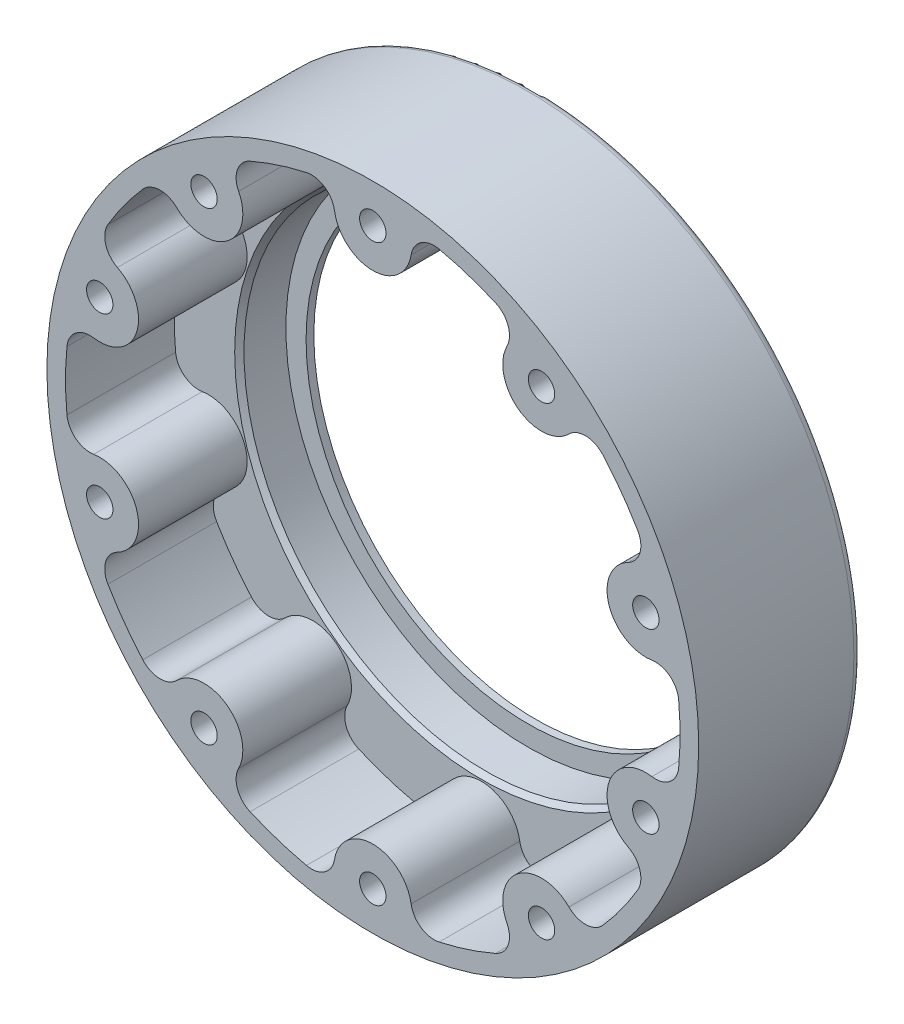
from build123d import *
from build123d.topology import SkipClean

# Parameters (mm, degrees)
ESQUISSE1_R             = 42
ESQUISSE1_R_2           = 31.2
BOSS_EXTRU_1_DEPTH      = 6
BOSS_EXTRU_2_START      = 1
ESQUISSE2_R             = 42
ESQUISSE2_R_2           = 28.6
BOSS_EXTRU_2_DEPTH      = 1
ESQUISSE3_R             = 5
BOSS_EXTRU_3_DEPTH      = 14
ESQUISSE4_R             = 42
ESQUISSE4_R_2           = 39.6
BOSS_EXTRU_4_DEPTH      = 14
CONG_1_R                = 3
ESQUISSE5_R             = 1.7
ENL_V_MAT_EXTRU_1_DEPTH = 64.000000167
ESQUISSE6_R             = 3
ENL_V_MAT_EXTRU_2_DEPTH = 3.2
CHANFREIN1_SIZE         = 0.6
CONG_2_R                = 1


with BuildPart() as part:
    # Esquisse1 → Boss.-Extru.1 (new body)
    with BuildSketch(Plane.XY):
        Circle(ESQUISSE1_R)
        Circle(ESQUISSE1_R_2, mode=Mode.SUBTRACT)
    extrude(amount=BOSS_EXTRU_1_DEPTH)

    # Esquisse2 → Boss.-Extru.2 (add)
    with BuildSketch(Plane(origin=(0, 0, 0), x_dir=(-1, 0, 0), z_dir=(0, 0, -1)).offset(BOSS_EXTRU_2_START)):
        Circle(ESQUISSE2_R)
        Circle(ESQUISSE2_R_2, mode=Mode.SUBTRACT)
    extrude(amount=-BOSS_EXTRU_2_DEPTH)

    # Esquisse3 → Boss.-Extru.3 (add)
    with BuildSketch(Plane.XY.offset(6)):
        with Locations(Location((0, 37, 0), (0, 0, 89.999613921))):
            Circle(ESQUISSE3_R)
        with Locations(Location((21.748054335, 29.933628792, 0), (0, 0, 53.999609041))):
            Circle(ESQUISSE3_R)
        with Locations(Location((35.189091103, 11.433628792, 0), (0, 0, 17.999603008))):
            Circle(ESQUISSE3_R)
        with Locations(Location((35.189091103, -11.433628792, 0), (0, 0, 341.999598271))):
            Circle(ESQUISSE3_R)
        with Locations(Location((21.748054335, -29.933628792, 0), (0, 0, 305.999596518))):
            Circle(ESQUISSE3_R)
        with Locations(Location((0, -37, 0), (0, 0, 269.999598257))):
            Circle(ESQUISSE3_R)
        with Locations(Location((-21.748054335, -29.933628792, 0), (0, 0, 233.999602875))):
            Circle(ESQUISSE3_R)
        with Locations(Location((-35.189091103, -11.433628792, 0), (0, 0, 197.999608525))):
            Circle(ESQUISSE3_R)
        with Locations(Location((-35.189091103, 11.433628792, 0), (0, 0, 161.99961318))):
            Circle(ESQUISSE3_R)
        with Locations(Location((-21.748054335, 29.933628792, 0), (0, 0, 125.999614883))):
            Circle(ESQUISSE3_R)
    extrude(amount=BOSS_EXTRU_3_DEPTH)

    # Esquisse4 → Boss.-Extru.4 (add)
    with SkipClean():  # the faces are left unmerged after this step: merging them gives an invalid solid
        with BuildSketch(Plane.XY.offset(6)):
            with Locations(Location((0, 0, 0), (0, 0, 180))):
                Circle(ESQUISSE4_R)
            Circle(ESQUISSE4_R_2, mode=Mode.SUBTRACT)
        extrude(amount=BOSS_EXTRU_4_DEPTH)

    # Congé1
    cong_1_edges = [part.edges().sort_by_distance(p)[0] for p in [
        (-4.411459412, 39.353513514, 13),
        (4.411459412, 39.353513514, 13),
        (19.562469235, 34.430652004, 13),
        (26.700360503, 29.244670437, 13),
        (36.064199538, 16.356451684, 13),
        (38.790631394, 7.965357244, 13),
        (38.790631394, -7.965357244, 13),
        (36.064199538, -16.356451684, 13),
        (26.700360503, -29.244670437, 13),
        (19.562469235, -34.430652004, 13),
        (4.411459412, -39.353513514, 13),
        (-4.411459412, -39.353513514, 13),
        (-19.562469235, -34.430652004, 13),
        (-26.700360503, -29.244670437, 13),
        (-36.064199538, -16.356451684, 13),
        (-38.790631394, -7.965357244, 13),
        (-38.790631394, 7.965357244, 13),
        (-36.064199538, 16.356451684, 13),
        (-26.700360503, 29.244670437, 13),
        (-19.562469235, 34.430652004, 13),
    ]]
    fillet(cong_1_edges, radius=CONG_1_R)

    # Esquisse5 → Enlèv. mat.-Extru.1 (cut, through all)
    with BuildSketch(Plane(origin=(0, 0, -1), x_dir=(-1, 0, 0), z_dir=(0, 0, -1))):
        with Locations((0, 37)):
            Circle(ESQUISSE5_R)
        with Locations((21.748054335, 29.933628792)):
            Circle(ESQUISSE5_R)
        with Locations((35.189091103, 11.433628792)):
            Circle(ESQUISSE5_R)
        with Locations((35.189091103, -11.433628792)):
            Circle(ESQUISSE5_R)
        with Locations((21.748054335, -29.933628792)):
            Circle(ESQUISSE5_R)
        with Locations((0, -37)):
            Circle(ESQUISSE5_R)
        with Locations((-21.748054335, -29.933628792)):
            Circle(ESQUISSE5_R)
        with Locations((-35.189091103, -11.433628792)):
            Circle(ESQUISSE5_R)
        with Locations((-35.189091103, 11.433628792)):
            Circle(ESQUISSE5_R)
        with Locations((-21.748054335, 29.933628792)):
            Circle(ESQUISSE5_R)
    extrude(amount=-ENL_V_MAT_EXTRU_1_DEPTH, mode=Mode.SUBTRACT)

    # Esquisse6 → Enlèv. mat.-Extru.2 (cut)
    with BuildSketch(Plane(origin=(0, 0, -1), x_dir=(-1, 0, 0), z_dir=(0, 0, -1))):
        with Locations((0, 37)):
            Circle(ESQUISSE6_R)
        with Locations((21.748054335, 29.933628792)):
            Circle(ESQUISSE6_R)
        with Locations((35.189091103, 11.433628792)):
            Circle(ESQUISSE6_R)
        with Locations((35.189091103, -11.433628792)):
            Circle(ESQUISSE6_R)
        with Locations((21.748054335, -29.933628792)):
            Circle(ESQUISSE6_R)
        with Locations((0, -37)):
            Circle(ESQUISSE6_R)
        with Locations((-21.748054335, -29.933628792)):
            Circle(ESQUISSE6_R)
        with Locations((-35.189091103, -11.433628792)):
            Circle(ESQUISSE6_R)
        with Locations((-35.189091103, 11.433628792)):
            Circle(ESQUISSE6_R)
        with Locations((-21.748054335, 29.933628792)):
            Circle(ESQUISSE6_R)
    extrude(amount=-ENL_V_MAT_EXTRU_2_DEPTH, mode=Mode.SUBTRACT)

    # Chanfrein1
    chanfrein1_edges = [part.edges().sort_by_distance(p)[0] for p in [
        (-31.2, 0, 6),
    ]]
    chamfer(chanfrein1_edges, length=CHANFREIN1_SIZE)

    # Congé2
    cong_2_edges = [part.edges().sort_by_distance(p)[0] for p in [
        (42, 0, -1),
    ]]
    fillet(cong_2_edges, radius=CONG_2_R - 0.0001)  # a hair under: the kernel refuses the full size


solid = part.part
